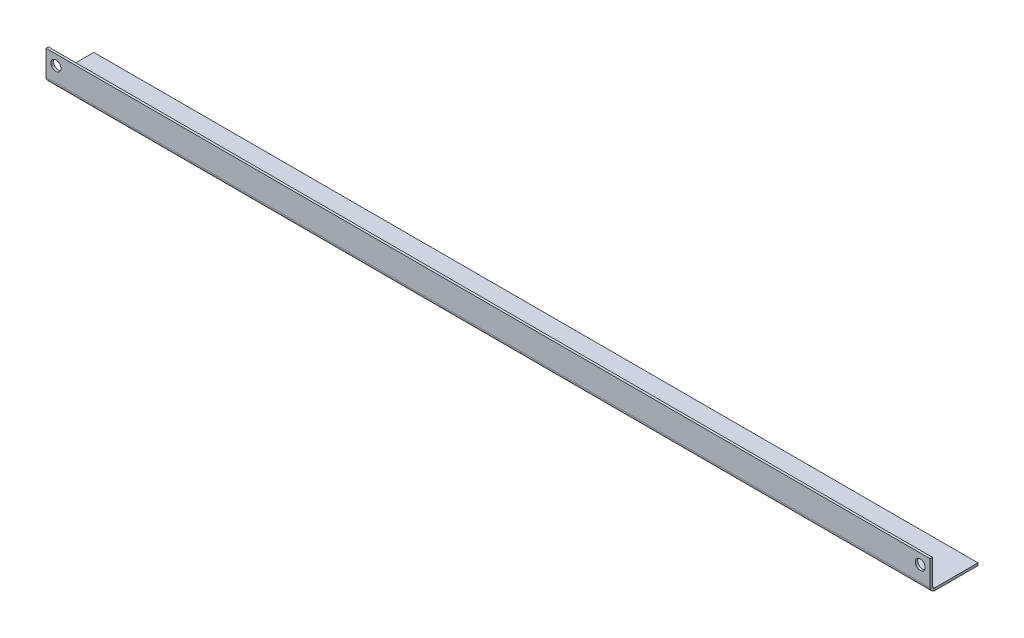
from build123d import *

# Parameters (mm, degrees)
SKETCH1_W                    = 444
SKETCH1_H                    = 24
BASE_FLANGE1_DEPTH           = 1.214
EDGE_FLANGE1_STRIP_W         = 7.284
EDGE_FLANGE1_STRIP_H         = 1.214
EDGE_FLANGE1_STRIP_CUT_DEPTH = 444
EDGE_FLANGE1_DEPTH           = 444
SKETCH9_R                    = 2.5
CUT_EXTRUDE1_DEPTH           = 10


# Sheet-metal steps are written as plain solids
with BuildPart() as part:
    # Sketch1 → Base-Flange1 (new body)
    with BuildSketch(Plane(origin=(0, 0, 0), x_dir=(1, 0, 0), z_dir=(0, 1, 0))):
        Rectangle(SKETCH1_W, SKETCH1_H)
    extrude(amount=BASE_FLANGE1_DEPTH)

    # Edge-Flange1 strip (across the edge) → Edge-Flange1 strip cut (cut)
    with BuildSketch(Plane(origin=(-222, 1.214, 12), x_dir=(0, 0, -1), z_dir=(1, 0, 0))):
        with Locations((-1.214, -0.607)):
            Rectangle(EDGE_FLANGE1_STRIP_W, EDGE_FLANGE1_STRIP_H)
    extrude(amount=EDGE_FLANGE1_STRIP_CUT_DEPTH, mode=Mode.SUBTRACT)

    # Edge-Flange1 section (across the edge) → Edge-Flange1 (add)
    with BuildSketch(Plane(origin=(-222, 1.214, 12), x_dir=(0, 0, -1), z_dir=(1, 0, 0))):
        with BuildLine():
            Line((0, 1.214), (0, 13.786))
            Line((0, 13.786), (1.214, 13.786))
            Line((1.214, 13.786), (1.214, 1.214))
            ThreePointArc((1.214, 1.214), (1.569572368, 0.355572368), (2.428, 0))
            Line((2.428, 0), (2.428, -1.214))
            ThreePointArc((2.428, -1.214), (0.711144735, -0.502855265), (0, 1.214))
        make_face()
    extrude(amount=EDGE_FLANGE1_DEPTH)

    # Sketch9 → Cut-Extrude1 (cut)
    with BuildSketch(Plane.XY.offset(12)):
        with Locations((217, 9.928)):
            Circle(SKETCH9_R)
        with Locations((-217, 9.928)):
            Circle(SKETCH9_R)
    extrude(amount=-CUT_EXTRUDE1_DEPTH, mode=Mode.SUBTRACT)


solid = part.part
